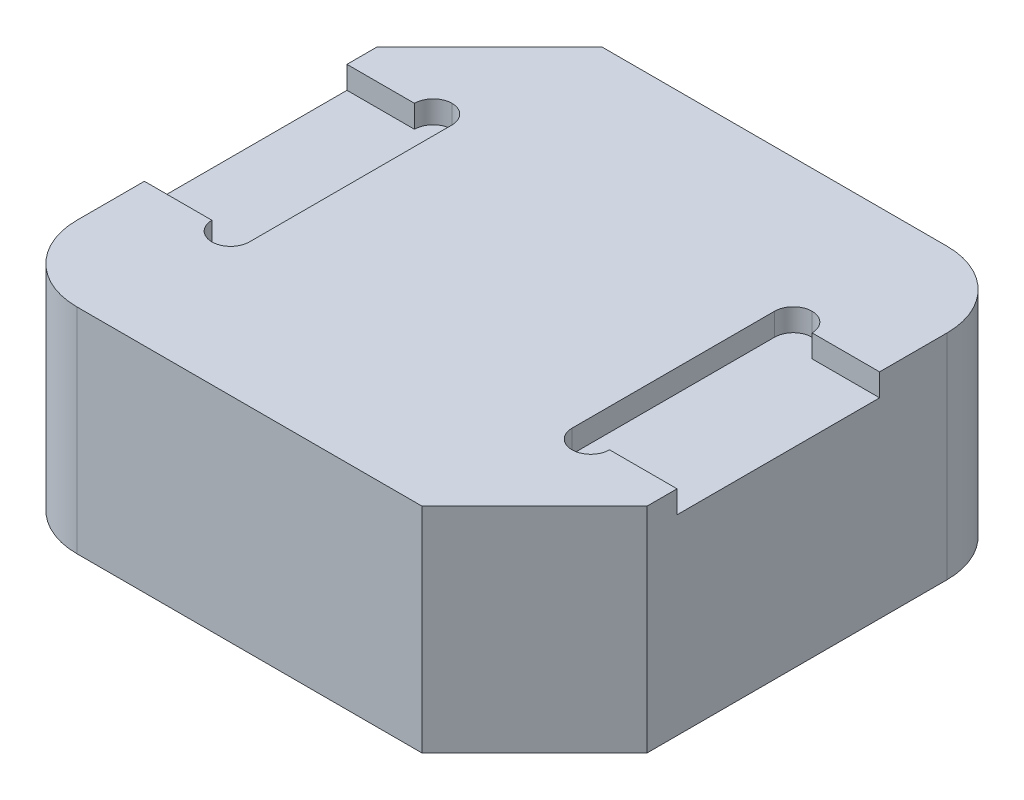
from build123d import *

# Parameters (mm, degrees)
SKETCH1_W            = 7.1
SKETCH1_H            = 6.5
BOSS_EXTRUDE1_DEPTH  = 2.85
CHAMFER1_SIZE        = 1.5
FILLET1_R            = 1
SKETCH2_W            = 0.9
SKETCH2_H            = 2.7
CUT_EXTRUDE1_DEPTH   = 0.3
SKETCH3_W            = 0.5
SKETCH3_H            = 3.2
CUT_EXTRUDE2_DEPTH   = 0.3
FILLET2_R            = 0.25
FILLET2_OF_MIRROR1_R = 0.25


with BuildPart() as part:
    # Sketch1 → Boss-Extrude1 (new body)
    with BuildSketch(Plane(origin=(0, 0, 0), x_dir=(1, 0, 0), z_dir=(0, 1, 0))):
        Rectangle(SKETCH1_W, SKETCH1_H)
    extrude(amount=BOSS_EXTRUDE1_DEPTH)

    # Chamfer1
    chamfer1_edges = [part.edges().sort_by_distance(p)[0] for p in [
        (3.55, 1.425, 3.25),
        (-3.55, 1.425, -3.25),
    ]]
    chamfer(chamfer1_edges, length=CHAMFER1_SIZE)

    # Fillet1
    fillet1_edges = [part.edges().sort_by_distance(p)[0] for p in [
        (-3.55, 1.425, 3.25),
        (3.55, 1.425, -3.25),
    ]]
    fillet(fillet1_edges, radius=FILLET1_R)

    # Sketch2 → Cut-Extrude1 (cut)
    with BuildSketch(Plane(origin=(0, 2.85, 0), x_dir=(1, 0, 0), z_dir=(0, 1, 0))):
        with Locations((3.1, 0)):
            Rectangle(SKETCH2_W, SKETCH2_H)
    cut_extrude1 = extrude(amount=-CUT_EXTRUDE1_DEPTH, mode=Mode.SUBTRACT)

    # Sketch3 → Cut-Extrude2 (cut)
    with BuildSketch(Plane(origin=(0, 2.85, 0), x_dir=(1, 0, 0), z_dir=(0, 1, 0))):
        with Locations((2.4, 0)):
            Rectangle(SKETCH3_W, SKETCH3_H)
    cut_extrude2 = extrude(amount=-CUT_EXTRUDE2_DEPTH, mode=Mode.SUBTRACT)

    # Fillet2
    fillet2_edges = [part.edges().sort_by_distance(p)[0] for p in [
        (2.65, 2.7, 1.6),
        (2.15, 2.7, 1.6),
        (2.65, 2.7, -1.6),
        (2.15, 2.7, -1.6),
    ]]
    fillet(fillet2_edges, radius=FILLET2_R - 0.0001)  # a hair under: the kernel refuses the full size

    # Mirror1: Cut-Extrude1, Cut-Extrude2 across plane
    add(cut_extrude1.mirror(Plane(origin=(0, 0, 0), x_dir=(0, 0, 1), z_dir=(1, 0, 0))), mode=Mode.SUBTRACT)
    add(cut_extrude2.mirror(Plane(origin=(0, 0, 0), x_dir=(0, 0, 1), z_dir=(1, 0, 0))), mode=Mode.SUBTRACT)

    # Fillet2 of Mirror1
    fillet2_of_mirror1_edges = [part.edges().sort_by_distance(p)[0] for p in [
        (-2.65, 2.7, 1.6),
        (-2.15, 2.7, 1.6),
        (-2.65, 2.7, -1.6),
        (-2.15, 2.7, -1.6),
    ]]
    fillet(fillet2_of_mirror1_edges, radius=FILLET2_OF_MIRROR1_R - 0.0001)  # a hair under: the kernel refuses the full size


solid = part.part
